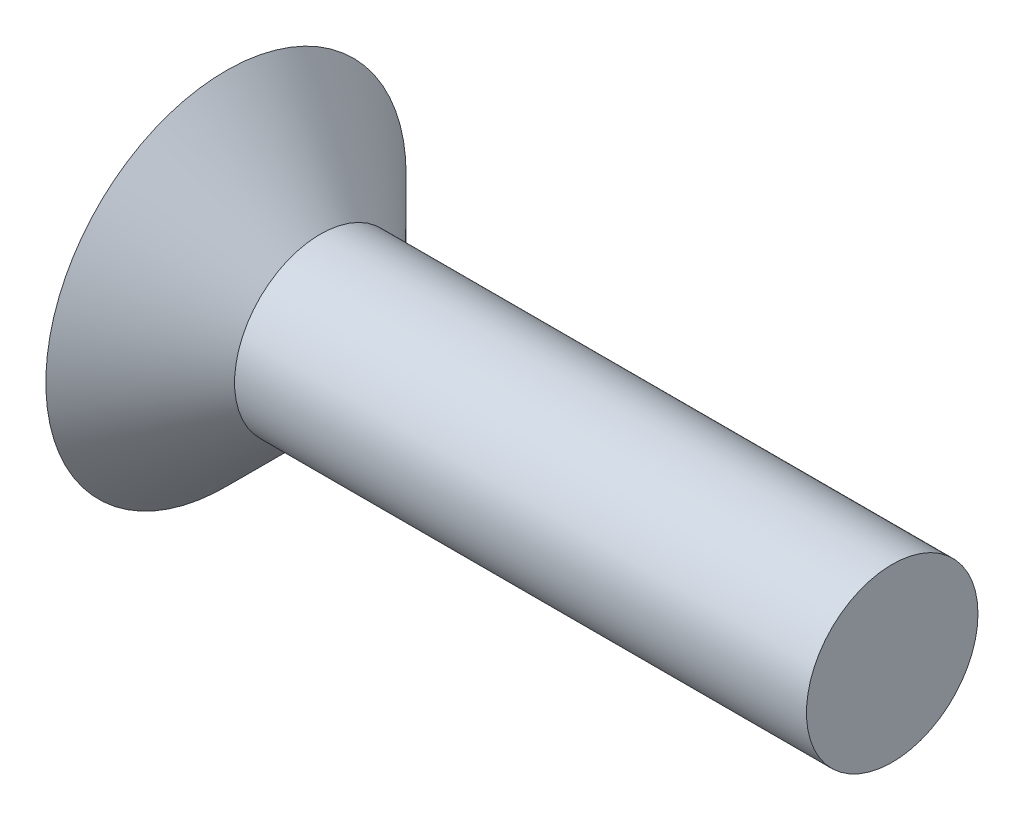
from build123d import *


with BuildPart() as part:
    # Эскиз1 → Повернуть1 (revolve)
    with BuildSketch(Plane.XY):
        Polygon((0, 0), (0, 3.15), (1.65, 1.5), (11.65, 1.5), (11.65, 0), align=None)
    revolve(axis=Axis((0, 0, 0), (-1, 0, 0)))


solid = part.part
